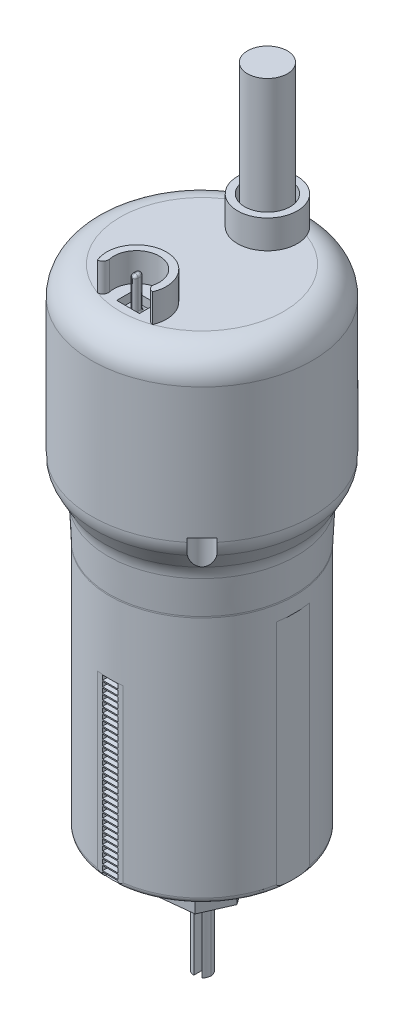
from build123d import *

# Parameters (mm, degrees)
ESBO_O1_R                          = 38.75
RESSALTO_EXTRUS_O1_DEPTH           = 60
RESSALTO_EXTRUS_O1_OTHER_WAY_DEPTH = 10
RESSALTO_EXTRUS_O1_OTHER_WAY_TAPER = 29
ESBO_O3_R                          = 33.206909485
RESSALTO_EXTRUS_O2_DEPTH           = 14.5
RESSALTO_EXTRUS_O2_TAPER           = 2.75
ESBO_O5_R                          = 32.51042454
RESSALTO_EXTRUS_O3_DEPTH           = 87.5
ESBO_O6_R                          = 7
RESSALTO_EXTRUS_O4_DEPTH           = 6
RESSALTO_EXTRUS_O6_DEPTH           = 12
ESBO_O9_R                          = 3.5
CORTE_EXTRUS_O1_DEPTH              = 30
FILETE1_R                          = 10
ESBO_O10_R                         = 10.5
ESBO_O10_R_2                       = 8
RESSALTO_EXTRUS_O7_DEPTH           = 10
ESBO_O11_R                         = 7
RESSALTO_EXTRUS_O8_DEPTH           = 50
FILETE4_R                          = 2
ESBO_O12_W                         = 8
ESBO_O12_H                         = 6
CORTE_EXTRUS_O2_DEPTH              = 3
ESBO_O13_W                         = 2
ESBO_O13_H                         = 3
RESSALTO_EXTRUS_O9_DEPTH           = 12
FILETE5_R                          = 1
FILETE6_R                          = 10
FILETE7_R                          = 2
ESBO_O16_W                         = 24.094372832
ESBO_O16_H                         = 85.038962937
ESBO_O16_W_2                       = 43.228139493
CORTE_EXTRUS_O3_DEPTH              = 82
ESBO_O17_W                         = 96.113782953
ESBO_O17_H                         = 18.801347087
CORTE_EXTRUS_O6_DEPTH              = 62
ESBO_O18_W                         = 5.5
ESBO_O18_H                         = 1.6
CORTE_EXTRUS_O7_DEPTH              = 2
CORTE_EXTRUS_O7_TAPER              = 6
ESBO_O19_R                         = 3.75
CORTE_EXTRUS_O8_DEPTH              = 34
ESBO_O20_R                         = 3
RESSALTO_EXTRUS_O10_DEPTH          = 30
ESBO_O21_R                         = 3.25
RESSALTO_EXTRUS_O11_DEPTH          = 25
CORTE_EXTRUS_O10_START             = -25
CORTE_EXTRUS_O10_DEPTH             = 25


# Some blends are built 0.0001 mm under size
with BuildPart() as part:
    # Esboço1 → Ressalto-extrusão1 (new body)
    with BuildSketch(Plane(origin=(0, 0, 0), x_dir=(1, 0, 0), z_dir=(0, 1, 0))):
        with Locations(Location((0, 0, 0), (0, 0, 270))):
            Circle(ESBO_O1_R)
    extrude(amount=RESSALTO_EXTRUS_O1_DEPTH)

    # Esboço1 → Ressalto-extrusão1 other way (add)
    with BuildSketch(Plane(origin=(0, 0, 0), x_dir=(1, 0, 0), z_dir=(0, 1, 0))):
        with Locations(Location((0, 0, 0), (0, 0, 270))):
            Circle(ESBO_O1_R)
    extrude(amount=-RESSALTO_EXTRUS_O1_OTHER_WAY_DEPTH, taper=RESSALTO_EXTRUS_O1_OTHER_WAY_TAPER)

    # Esboço3 → Ressalto-extrusão2 (add)
    with BuildSketch(Plane.XZ.offset(10)):
        Circle(ESBO_O3_R)
    extrude(amount=RESSALTO_EXTRUS_O2_DEPTH, taper=RESSALTO_EXTRUS_O2_TAPER)

    # Esboço5 → Ressalto-extrusão3 (add)
    with BuildSketch(Plane.XZ.offset(24.5)):
        with Locations(Location((0, 0, 0), (0, 0, 270))):
            Circle(ESBO_O5_R)
    extrude(amount=RESSALTO_EXTRUS_O3_DEPTH)

    # Esboço6 → Ressalto-extrusão4 (add)
    with BuildSketch(Plane.XZ.offset(112)):
        with Locations(Location((0, 0, 0), (0, 0, 270))):
            Circle(ESBO_O6_R)
    extrude(amount=RESSALTO_EXTRUS_O4_DEPTH)

    # Esboço7 → Ressalto-extrusão6 (add)
    with BuildSketch(Plane.XZ.offset(118)):
        Polygon((-6.595454957, -9.017065704), (4.511280489, -10.220364394), (11.106735446, -1.20329869), (6.595454957, 9.017065704), (-4.511280489, 10.220364394), (-11.106735446, 1.20329869), align=None)
    extrude(amount=RESSALTO_EXTRUS_O6_DEPTH)

    # Esboço9 → Corte-extrusão1 (cut)
    with BuildSketch(Plane.XZ.offset(130)):
        with Locations(Location((0, 0, 0), (0, 0, 270))):
            Circle(ESBO_O9_R)
    extrude(amount=-CORTE_EXTRUS_O1_DEPTH, mode=Mode.SUBTRACT)

    # Filete1
    filete1_edges = [part.edges().sort_by_distance(p)[0] for p in [
        (0, 60, -38.75),
    ]]
    fillet(filete1_edges, radius=FILETE1_R)

    # Esboço10 → Ressalto-extrusão7 (add)
    # profile 1 of 2: a face of its own
    with BuildSketch(Plane(origin=(0, 60, 0), x_dir=(1, 0, 0), z_dir=(0, 1, 0))):
        with Locations(Location((0, 23, 0), (0, 0, 157.181665587))):
            Circle(ESBO_O10_R)
        with Locations(Location((0, 23, 0), (0, 0, 39.396307088))):
            Circle(ESBO_O10_R_2, mode=Mode.SUBTRACT)
    # profile 2 of 2: a face of its own
    with BuildSketch(Plane(origin=(0, 60, 0), x_dir=(1, 0, 0), z_dir=(0, 1, 0))):
        with BuildLine():
            ThreePointArc((-6.18219586, -28.077445652), (0, -15), (6.18219586, -28.077445652))
            ThreePointArc((6.18219586, -28.077445652), (7.946146503, -27.630078823), (9.678260561, -27.07201087))
            ThreePointArc((9.678260561, -27.07201087), (0, -12.5), (-9.678260561, -27.07201087))
            ThreePointArc((-9.678260561, -27.07201087), (-7.946146503, -27.630078823), (-6.18219586, -28.077445652))
        make_face()
    extrude(amount=RESSALTO_EXTRUS_O7_DEPTH)

    # Esboço11 → Ressalto-extrusão8 (add)
    with BuildSketch(Plane(origin=(0, 60, 0), x_dir=(1, 0, 0), z_dir=(0, 1, 0))):
        with Locations(Location((0, 23, 0), (0, 0, 129.472189983))):
            Circle(ESBO_O11_R)
    extrude(amount=RESSALTO_EXTRUS_O8_DEPTH)

    # Filete4
    # the kernel refuses this fillet: 2 mm, written as the material it takes off along each edge
    with BuildSketch(Plane(origin=(6.18219586, 60, 28.077445652), x_dir=(0.961046219926371, 0, -0.27638770443931404), z_dir=(0, 1, 0))) as filete4_piece_1:
        with BuildLine():
            CenterArc((4.289886103, 1.890699351), FILETE4_R, 151.980998785, 98.989299345)
            ThreePointArc((2.5243024, 2.830228055), (1.432283965, 1.263371292), (0, 0))
            ThreePointArc((0, 0), (1.818884788, -0.057594069), (3.637769577, 0))
        make_face()
    extrude(amount=19.48099858, mode=Mode.SUBTRACT)
    with BuildSketch(Plane(origin=(-6.18219586, 60, 28.077445652), x_dir=(-0.9610462199263712, 0, -0.2763877044393129), z_dir=(0, 1, 0))) as filete4_piece_2:
        with BuildLine():
            CenterArc((4.289886103, -1.890699351), FILETE4_R, 109.02970187, 98.989299345)
            ThreePointArc((2.5243024, -2.830228055), (1.432283965, -1.263371292), (0, 0))
            ThreePointArc((0, 0), (1.818884788, 0.057594069), (3.637769577, 0))
        make_face()
    extrude(amount=19.48099858, mode=Mode.SUBTRACT)

    # Esboço12 → Corte-extrusão2 (cut)
    with BuildSketch(Plane(origin=(0, 60, 0), x_dir=(1, 0, 0), z_dir=(0, 1, 0))):
        with Locations((0, -23)):
            Rectangle(ESBO_O12_W, ESBO_O12_H)
    extrude(amount=-CORTE_EXTRUS_O2_DEPTH, mode=Mode.SUBTRACT)

    # Esboço13 → Ressalto-extrusão9 (add)
    with BuildSketch(Plane(origin=(0, 57, 0), x_dir=(1, 0, 0), z_dir=(0, 1, 0))):
        with Locations((0, -23)):
            Rectangle(ESBO_O13_W, ESBO_O13_H)
    extrude(amount=RESSALTO_EXTRUS_O9_DEPTH)

    # Filete5
    filete5_edges = [part.edges().sort_by_distance(p)[0] for p in [
        (-1, 57, 23),
        (-1, 63, 21.5),
        (0, 57, 24.5),
        (-1, 63, 24.5),
        (1, 57, 23),
        (1, 63, 24.5),
        (0, 57, 21.5),
        (1, 63, 21.5),
        (-1, 69, 23),
        (0, 69, 24.5),
        (1, 69, 23),
        (0, 69, 21.5),
    ]]
    fillet(filete5_edges, radius=FILETE5_R - 0.0001)  # a hair under: the kernel refuses the full size

    # Filete6
    # the kernel refuses this fillet: 10 mm, written as the material it adds along each edge
    with BuildSketch(Plane(origin=(0, -10, 0), x_dir=(1, 0, 0), z_dir=(0, 0, 1))) as filete6_piece_1:
        with BuildLine():
            CenterArc((33.206909485 + FILETE6_R * 0.987661455934, -FILETE6_R * 0.280876907081), FILETE6_R, 151, 26.25)
            Line((33.206909485 - FILETE6_R * 0.0111869305506, -FILETE6_R * 0.23289877856), (33.206909485 - FILETE6_R * 0.0311638982803, -FILETE6_R * 0.231939215989))
            Line((33.206909485 - FILETE6_R * 0.0311638982803, -FILETE6_R * 0.231939215989), (33.206909485 - FILETE6_R * 0.0197532291187, FILETE6_R * 0.00561753814162))
            Line((33.206909485 - FILETE6_R * 0.0197532291187, FILETE6_R * 0.00561753814162), (33.206909485 + FILETE6_R * 0.0955493546522, FILETE6_R * 0.21362890557))
            Line((33.206909485 + FILETE6_R * 0.0955493546522, FILETE6_R * 0.21362890557), (33.206909485 + FILETE6_R * 0.113041748795, FILETE6_R * 0.203932713165))
        make_face()
    filete6_piece_1_solid = revolve(axis=Axis((0, -10, 0), (0, 1, 0)), revolution_arc=270, mode=Mode.PRIVATE)
    with BuildSketch(Plane(origin=(0, -24.5, 0), x_dir=(0, 0, -1), z_dir=(1, 0, 0))) as filete6_piece_2:
        with BuildLine():
            CenterArc((32.51042454 + FILETE6_R, -FILETE6_R * 0.0240028852842), FILETE6_R, 177.25, 2.75)
            Line((32.51042454, -FILETE6_R * 0.0240028852842), (32.51042454 - FILETE6_R * 0.02, -FILETE6_R * 0.0240028852842))
            Line((32.51042454 - FILETE6_R * 0.02, -FILETE6_R * 0.0240028852842), (32.51042454 - FILETE6_R * 0.02, FILETE6_R * 0.000480057705684))
            Line((32.51042454 - FILETE6_R * 0.02, FILETE6_R * 0.000480057705684), (32.51042454 - FILETE6_R * 0.0188253542146, FILETE6_R * 0.0249348058076))
            Line((32.51042454 - FILETE6_R * 0.0188253542146, FILETE6_R * 0.0249348058076), (32.51042454 + FILETE6_R * 0.00115161351505, FILETE6_R * 0.0239752432371))
        make_face()
    filete6_piece_2_solid = revolve(axis=Axis((0, -24.5, 0), (0, 1, 0)), revolution_arc=270, mode=Mode.PRIVATE)
    with BuildSketch(Plane(origin=(0, -24.5, 0), x_dir=(1, 0, 0), z_dir=(0, 0, 1))) as filete6_piece_3:
        with BuildLine():
            CenterArc((32.51042454 + FILETE6_R, -FILETE6_R * 0.0240028852842), FILETE6_R, 177.25, 2.75)
            Line((32.51042454, -FILETE6_R * 0.0240028852842), (32.51042454 - FILETE6_R * 0.02, -FILETE6_R * 0.0240028852842))
            Line((32.51042454 - FILETE6_R * 0.02, -FILETE6_R * 0.0240028852842), (32.51042454 - FILETE6_R * 0.02, FILETE6_R * 0.000480057705684))
            Line((32.51042454 - FILETE6_R * 0.02, FILETE6_R * 0.000480057705684), (32.51042454 - FILETE6_R * 0.0188253542146, FILETE6_R * 0.0249348058076))
            Line((32.51042454 - FILETE6_R * 0.0188253542146, FILETE6_R * 0.0249348058076), (32.51042454 + FILETE6_R * 0.00115161351505, FILETE6_R * 0.0239752432371))
        make_face()
    filete6_piece_3_solid = revolve(axis=Axis((0, -24.5, 0), (0, 1, 0)), revolution_arc=90, mode=Mode.PRIVATE)
    with BuildSketch(Plane(origin=(0, -10, 0), x_dir=(0, 0, 1), z_dir=(-1, 0, 0))) as filete6_piece_4:
        with BuildLine():
            CenterArc((33.206909485 + FILETE6_R * 0.987661455934, -FILETE6_R * 0.280876907081), FILETE6_R, 151, 26.25)
            Line((33.206909485 - FILETE6_R * 0.0111869305506, -FILETE6_R * 0.23289877856), (33.206909485 - FILETE6_R * 0.0311638982803, -FILETE6_R * 0.231939215989))
            Line((33.206909485 - FILETE6_R * 0.0311638982803, -FILETE6_R * 0.231939215989), (33.206909485 - FILETE6_R * 0.0197532291187, FILETE6_R * 0.00561753814162))
            Line((33.206909485 - FILETE6_R * 0.0197532291187, FILETE6_R * 0.00561753814162), (33.206909485 + FILETE6_R * 0.0955493546522, FILETE6_R * 0.21362890557))
            Line((33.206909485 + FILETE6_R * 0.0955493546522, FILETE6_R * 0.21362890557), (33.206909485 + FILETE6_R * 0.113041748795, FILETE6_R * 0.203932713165))
        make_face()
    filete6_piece_4_solid = revolve(axis=Axis((0, -10, 0), (0, 1, 0)), revolution_arc=90, mode=Mode.PRIVATE)
    add([filete6_piece_1_solid, filete6_piece_2_solid, filete6_piece_3_solid, filete6_piece_4_solid])
    # the kernel refuses this fillet: 10 mm, written as the material it takes off along each edge
    with BuildSketch(Plane(origin=(0, 0, 0), x_dir=(0, 0, 1), z_dir=(-1, 0, 0))) as filete6_2_piece_1:
        with BuildLine():
            CenterArc((38.75 - FILETE6_R, FILETE6_R * 0.258617584356), FILETE6_R, 331, 29)
            Line((38.75 - FILETE6_R * 0.125380292861, -FILETE6_R * 0.22619203589), (38.75 - FILETE6_R * 0.107887898718, -FILETE6_R * 0.235888228295))
            Line((38.75 - FILETE6_R * 0.107887898718, -FILETE6_R * 0.235888228295), (38.75 + FILETE6_R * 0.02, -FILETE6_R * 0.00517235168712))
            Line((38.75 + FILETE6_R * 0.02, -FILETE6_R * 0.00517235168712), (38.75 + FILETE6_R * 0.02, FILETE6_R * 0.258617584356))
            Line((38.75 + FILETE6_R * 0.02, FILETE6_R * 0.258617584356), (38.75, FILETE6_R * 0.258617584356))
        make_face()
    filete6_2_piece_1_solid = revolve(axis=Axis((0, 0, 0), (0, 1, 0)), mode=Mode.PRIVATE)
    add([filete6_2_piece_1_solid], mode=Mode.SUBTRACT)

    # Filete7
    filete7_edges = [part.edges().sort_by_distance(p)[0] for p in [
        (0, -112, 32.51042454),
    ]]
    fillet(filete7_edges, radius=FILETE7_R)

    # Esboço16 → Corte-extrusão3 (cut)
    with BuildSketch(Plane.XZ.offset(112)):
        with Locations((-44.047186416, -3.30707078)):
            Rectangle(ESBO_O16_W, ESBO_O16_H)
        with Locations((53.614069747, -3.30707078)):
            Rectangle(ESBO_O16_W_2, ESBO_O16_H)
    extrude(amount=-CORTE_EXTRUS_O3_DEPTH, mode=Mode.SUBTRACT)

    # Esboço17 → Corte-extrusão6 (cut)
    with BuildSketch(Plane.XZ.offset(112)):
        with Locations((0.980427964, 41.600673544)):
            Rectangle(ESBO_O17_W, ESBO_O17_H)
    extrude(amount=-CORTE_EXTRUS_O6_DEPTH, mode=Mode.SUBTRACT)

    # Esboço18 → Corte-extrusão7 (cut)
    with BuildSketch(Plane.XY.offset(32.2)):
        with Locations((6.9188e-05, -51.1)):
            Rectangle(ESBO_O18_W, ESBO_O18_H)
        with Locations((6.9188e-05, -53.1)):
            Rectangle(ESBO_O18_W, ESBO_O18_H)
        with Locations((6.9188e-05, -55.1)):
            Rectangle(ESBO_O18_W, ESBO_O18_H)
        with Locations((6.9188e-05, -57.1)):
            Rectangle(ESBO_O18_W, ESBO_O18_H)
        with Locations((6.9188e-05, -59.1)):
            Rectangle(ESBO_O18_W, ESBO_O18_H)
        with Locations((6.9188e-05, -61.1)):
            Rectangle(ESBO_O18_W, ESBO_O18_H)
        with Locations((6.9188e-05, -63.1)):
            Rectangle(ESBO_O18_W, ESBO_O18_H)
        with Locations((6.9188e-05, -65.1)):
            Rectangle(ESBO_O18_W, ESBO_O18_H)
        with Locations((6.9188e-05, -67.1)):
            Rectangle(ESBO_O18_W, ESBO_O18_H)
        with Locations((6.9188e-05, -69.1)):
            Rectangle(ESBO_O18_W, ESBO_O18_H)
        with Locations((6.9188e-05, -71.1)):
            Rectangle(ESBO_O18_W, ESBO_O18_H)
        with Locations((6.9188e-05, -73.1)):
            Rectangle(ESBO_O18_W, ESBO_O18_H)
        with Locations((6.9188e-05, -75.1)):
            Rectangle(ESBO_O18_W, ESBO_O18_H)
        with Locations((6.9188e-05, -77.1)):
            Rectangle(ESBO_O18_W, ESBO_O18_H)
        with Locations((6.9188e-05, -79.1)):
            Rectangle(ESBO_O18_W, ESBO_O18_H)
        with Locations((6.9188e-05, -81.1)):
            Rectangle(ESBO_O18_W, ESBO_O18_H)
        with Locations((6.9188e-05, -83.1)):
            Rectangle(ESBO_O18_W, ESBO_O18_H)
        with Locations((6.9188e-05, -85.1)):
            Rectangle(ESBO_O18_W, ESBO_O18_H)
        with Locations((6.9188e-05, -87.1)):
            Rectangle(ESBO_O18_W, ESBO_O18_H)
        with Locations((6.9188e-05, -89.1)):
            Rectangle(ESBO_O18_W, ESBO_O18_H)
        with Locations((6.9188e-05, -91.1)):
            Rectangle(ESBO_O18_W, ESBO_O18_H)
        with Locations((6.9188e-05, -93.1)):
            Rectangle(ESBO_O18_W, ESBO_O18_H)
        with Locations((6.9188e-05, -95.1)):
            Rectangle(ESBO_O18_W, ESBO_O18_H)
        with Locations((6.9188e-05, -97.1)):
            Rectangle(ESBO_O18_W, ESBO_O18_H)
        with Locations((6.9188e-05, -99.1)):
            Rectangle(ESBO_O18_W, ESBO_O18_H)
        with Locations((6.9188e-05, -101.1)):
            Rectangle(ESBO_O18_W, ESBO_O18_H)
        with Locations((6.9188e-05, -103.1)):
            Rectangle(ESBO_O18_W, ESBO_O18_H)
        with Locations((6.9188e-05, -105.1)):
            Rectangle(ESBO_O18_W, ESBO_O18_H)
        with Locations((6.9188e-05, -107.1)):
            Rectangle(ESBO_O18_W, ESBO_O18_H)
        with Locations((6.9188e-05, -109.1)):
            Rectangle(ESBO_O18_W, ESBO_O18_H)
        with Locations((6.9188e-05, -111.1)):
            Rectangle(ESBO_O18_W, ESBO_O18_H)
    extrude(amount=-CORTE_EXTRUS_O7_DEPTH, taper=CORTE_EXTRUS_O7_TAPER, mode=Mode.SUBTRACT)

    # Esboço19 → Corte-extrusão8 (cut)
    with BuildSketch(Plane.XZ.offset(30)):
        with Locations((-27, 27)):
            Circle(ESBO_O19_R)
        with Locations((27, 27)):
            Circle(ESBO_O19_R)
        with Locations((27, -27)):
            Circle(ESBO_O19_R)
        with Locations((-27, -27)):
            Circle(ESBO_O19_R)
    extrude(amount=-CORTE_EXTRUS_O8_DEPTH, mode=Mode.SUBTRACT)

    # Esboço20 → Ressalto-extrusão10 (add)
    with BuildSketch(Plane.XZ.offset(100)):
        with Locations(Location((0, 0, 0), (0, 0, 270))):
            Circle(ESBO_O20_R)
    extrude(amount=RESSALTO_EXTRUS_O10_DEPTH)

    # Esboço21 → Ressalto-extrusão11 (add)
    with BuildSketch(Plane.XZ.offset(130)):
        with Locations(Location((0, 0, 0), (0, 0, 270))):
            Circle(ESBO_O21_R)
    extrude(amount=RESSALTO_EXTRUS_O11_DEPTH)

    # Esboço23 → Corte-extrusão10 (cut)
    with BuildSketch(Plane.XZ.offset(155).offset(CORTE_EXTRUS_O10_START)):
        with BuildLine():
            Line((0, 2.869602611), (0, 0))
            Line((0, 0), (2.298097039, 2.298097039))
            ThreePointArc((2.298097039, 2.298097039), (-3.002608481, -1.243721155), (3.25, 0))
            ThreePointArc((3.25, 0), (2.21931416, -2.107898344), (0, -2.869602611))
            ThreePointArc((0, -2.869602611), (-2.869602611, 0), (0, 2.869602611))
        make_face()
    extrude(amount=CORTE_EXTRUS_O10_DEPTH, mode=Mode.SUBTRACT)


solid = part.part
